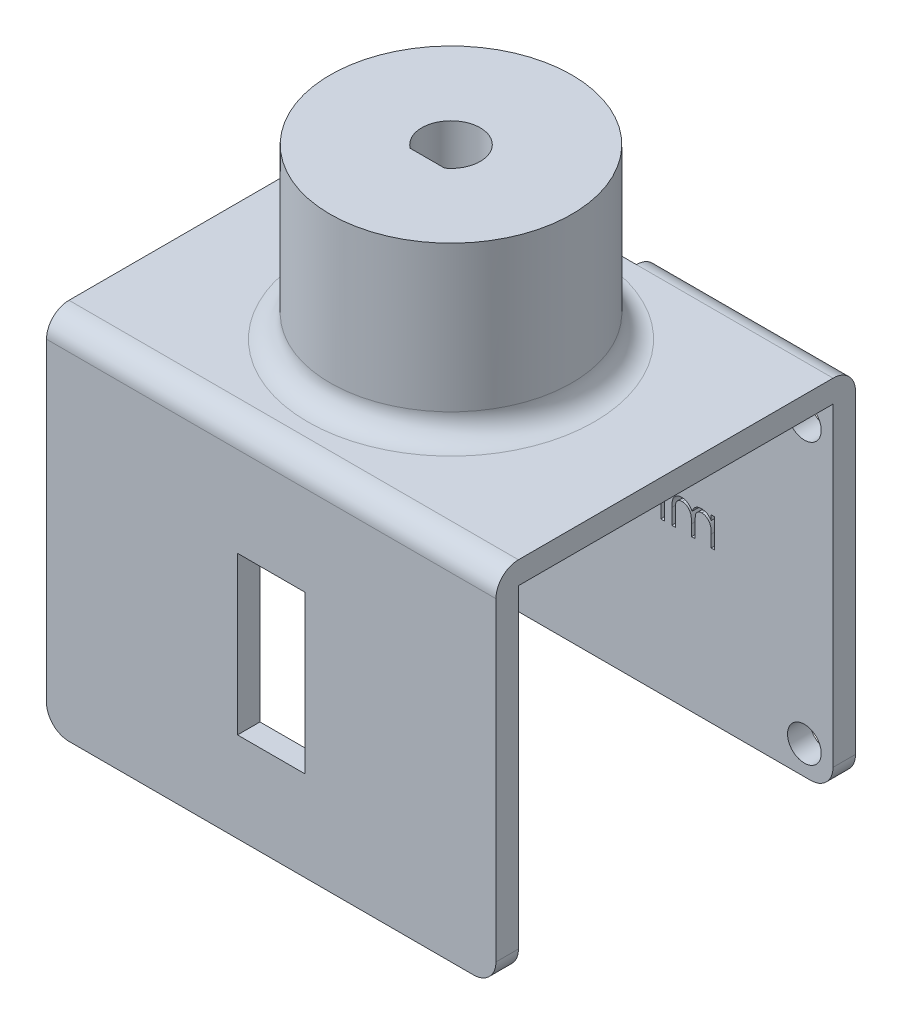
from build123d import *

# Parameters (mm, degrees)
SKETCH1_W           = 40
SKETCH1_H           = 32
BOSS_EXTRUDE1_DEPTH = 2
SKETCH2_R           = 10.75
BOSS_EXTRUDE2_DEPTH = 15
SKETCH3_R           = 8.5
CUT_EXTRUDE1_DEPTH  = 9.5
SKETCH5_W           = 4.322923329
SKETCH5_H           = 5.5
CUT_REVOLVE1_ANGLE  = 90
FILLET1_R           = 2
CUT_EXTRUDE2_REACH  = 32.741
SKETCH8_W           = 40
SKETCH8_H           = 2
BOSS_EXTRUDE3_DEPTH = 30
SKETCH10_R          = 1.5
SKETCH10_W          = 5
SKETCH10_H          = 6
SKETCH10_W_2        = 0.314102564
SKETCH10_H_2        = 2.557692307
CUT_EXTRUDE3_DEPTH  = 2
FILLET2_R           = 2
SKETCH11_W          = 6
SKETCH11_H          = 14
CUT_EXTRUDE4_DEPTH  = 10


with BuildPart() as part:
    # Sketch1 → Boss-Extrude1 (new body)
    with BuildSketch(Plane(origin=(0, 0, 0), x_dir=(1, 0, 0), z_dir=(0, 1, 0))):
        Rectangle(SKETCH1_W, SKETCH1_H)
    extrude(amount=BOSS_EXTRUDE1_DEPTH)

    # Sketch2 → Boss-Extrude2 (add)
    with BuildSketch(Plane(origin=(0, 2, 0), x_dir=(1, 0, 0), z_dir=(0, 1, 0))):
        with Locations(Location((0, 0, 0), (0, 0, 270))):
            Circle(SKETCH2_R)
    extrude(amount=BOSS_EXTRUDE2_DEPTH)

    # Sketch3 → Cut-Extrude1 (cut)
    with BuildSketch(Plane.XZ):
        with Locations(Location((0, 0, 0), (0, 0, 270))):
            Circle(SKETCH3_R)
    extrude(amount=-CUT_EXTRUDE1_DEPTH, mode=Mode.SUBTRACT)

    # Sketch5 → Cut-Revolve1 (revolve, cut)
    with BuildSketch(Plane.XY):
        with Locations((-8.588538336, 6.75)):
            Rectangle(SKETCH5_W, SKETCH5_H)
    revolve(axis=Axis((0, 0, 0), (0, -1, 0)), revolution_arc=CUT_REVOLVE1_ANGLE, mode=Mode.SUBTRACT)

    # Fillet1
    fillet1_edges = [part.edges().sort_by_distance(p)[0] for p in [
        (0, 2, -10.75),
    ]]
    fillet(fillet1_edges, radius=FILLET1_R - 0.0001)  # a hair under: the kernel refuses the full size

    # Sketch9 → Cut-Extrude2 (cut, up to next)
    with BuildSketch(Plane(origin=(0, 17, 0), x_dir=(1, 0, 0), z_dir=(0, 1, 0)), mode=Mode.PRIVATE) as cut_extrude2_sk1:
        with BuildLine():
            Line((-1.532970972, -2.1), (1.532970972, -2.1))
            ThreePointArc((1.532970972, -2.1), (0, 2.6), (-1.532970972, -2.1))
        make_face()
    cut_extrude2_tool1 = extrude(cut_extrude2_sk1.sketch, amount=-CUT_EXTRUDE2_REACH, mode=Mode.PRIVATE) & part.part
    add(cut_extrude2_tool1.solids().sort_by_distance((0, 17, -0.118931))[0], mode=Mode.SUBTRACT)

    # Sketch8 → Boss-Extrude3 (add)
    with BuildSketch(Plane.XZ):
        with Locations((0, -15)):
            Rectangle(SKETCH8_W, SKETCH8_H)
        with Locations((0, 15)):
            Rectangle(SKETCH8_W, SKETCH8_H)
    extrude(amount=BOSS_EXTRUDE3_DEPTH)

    # Sketch10 → Cut-Extrude3 (cut)
    # profile 1 of 13: a face of its own
    with BuildSketch(Plane(origin=(0, 0, -16), x_dir=(-1, 0, 0), z_dir=(0, 0, -1))):
        with Locations((-17.45, -2.55)):
            Circle(SKETCH10_R)
    # profile 2 of 13: a face of its own
    with BuildSketch(Plane(origin=(0, 0, -16), x_dir=(-1, 0, 0), z_dir=(0, 0, -1))):
        with Locations((17.45, -2.55)):
            Circle(SKETCH10_R)
    # profile 3 of 13: a face of its own
    with BuildSketch(Plane(origin=(0, 0, -16), x_dir=(-1, 0, 0), z_dir=(0, 0, -1))):
        with Locations((17.45, -27.45)):
            Circle(SKETCH10_R)
    # profile 4 of 13: a face of its own
    with BuildSketch(Plane(origin=(0, 0, -16), x_dir=(-1, 0, 0), z_dir=(0, 0, -1))):
        with Locations((-17.45, -27.45)):
            Circle(SKETCH10_R)
    # profile 5 of 13: a face of its own
    with BuildSketch(Plane(origin=(0, 0, -16), x_dir=(-1, 0, 0), z_dir=(0, 0, -1))):
        with Locations((0, -1)):
            Rectangle(SKETCH10_W, SKETCH10_H)
    # profile 6 of 13: a face of its own
    with BuildSketch(Plane(origin=(0, 0, -16), x_dir=(-1, 0, 0), z_dir=(0, 0, -1))):
        with BuildLine():
            Line((-9.472295897, -13.958841722), (-9.158193332, -13.958841722))
            Line((-9.158193332, -13.958841722), (-9.158193332, -14.403352939))
            add(Edge.make_bspline(
                [(-9.158193332, -14.403352939), (-9.129909382, -14.364465338), (-9.075714623, -14.289952965), (-8.98684897, -14.19176268), (-8.898072858, -14.108434526), (-8.834139476, -14.064691654), (-8.803425704, -14.043677459)],
                knots=[0, 0, 0, 0, 1.134379233, 2.173579362, 3.122582517, 4, 4, 4, 4], degree=3))
            add(Edge.make_bspline(
                [(-8.803425704, -14.043677459), (-8.761561042, -14.023672093), (-8.678563142, -13.98401088), (-8.547143917, -13.943777321), (-8.412669248, -13.91905222), (-8.321861034, -13.915670846), (-8.276182114, -13.913969927)],
                knots=[0, 0, 0, 0, 1.014936303, 2.012140481, 3.000054389, 4, 4, 4, 4], degree=3))
            add(Edge.make_bspline(
                [(-8.276182114, -13.913969927), (-8.245289118, -13.915015217), (-8.184153539, -13.917083792), (-8.093569449, -13.930543827), (-8.005710837, -13.95381), (-7.921096808, -13.986217324), (-7.841376128, -14.025464011), (-7.768286931, -14.071513719), (-7.702662722, -14.123210794), (-7.644536671, -14.182889727), (-7.592267646, -14.252226326), (-7.544188799, -14.333090574), (-7.499763587, -14.427298236), (-7.475142278, -14.495664777), (-7.462179711, -14.531658228)],
                knots=[0, 0, 0, 0, 1.009824226, 1.998387844, 2.986035974, 3.974953746, 4.955485308, 5.885931332, 6.793869504, 7.679848016, 8.601185859, 9.625726857, 10.749998409, 12, 12, 12, 12], degree=3))
            add(Edge.make_bspline(
                [(-7.462179711, -14.531658228), (-7.448468459, -14.506933809), (-7.421486642, -14.458279624), (-7.376181005, -14.389421361), (-7.328713209, -14.32501457), (-7.278678716, -14.265008145), (-7.226254129, -14.209698415), (-7.171192728, -14.158902513), (-7.113807947, -14.112402299), (-7.034015707, -14.05807914), (-6.9302031, -14.000377959), (-6.799314985, -13.950349515), (-6.663164813, -13.919433386), (-6.570747115, -13.915803113), (-6.524078749, -13.913969927)],
                knots=[0, 0, 0, 0, 0.86119277, 1.694706429, 2.50939023, 3.298075842, 4.073795165, 4.829715201, 5.57930267, 6.321991688, 7.768977793, 9.186738141, 10.579381044, 12, 12, 12, 12], degree=3))
            add(Edge.make_bspline(
                [(-6.524078749, -13.913969927), (-6.481197286, -13.915587148), (-6.3972741, -13.918752206), (-6.275096834, -13.943605679), (-6.161155029, -13.986283326), (-6.055677953, -14.044516963), (-5.960518139, -14.117696146), (-5.87780183, -14.204764984), (-5.808031467, -14.305107607), (-5.762452827, -14.399499595), (-5.731537563, -14.482834928), (-5.712476329, -14.55384122), (-5.695636634, -14.631992772), (-5.681655388, -14.717383034), (-5.671436836, -14.810313642), (-5.663866121, -14.910632518), (-5.658742047, -15.01841763), (-5.658379975, -15.09278313), (-5.658193332, -15.131117363)],
                knots=[0, 0, 0, 0, 1.209669288, 2.367440248, 3.500751976, 4.631527125, 5.755587489, 6.87532382, 8.007944318, 9.190864318, 9.82315674, 10.514484317, 11.263564316, 12.079023757, 12.955305781, 13.901327259, 14.918167583, 16, 16, 16, 16], degree=3))
            Line((-5.658193332, -15.131117363), (-5.658193332, -16.516534029))
            Line((-5.658193332, -16.516534029), (-5.972295897, -16.516534029))
            Line((-5.972295897, -16.516534029), (-5.972295897, -15.129715119))
            add(Edge.make_bspline(
                [(-5.972295897, -15.129715119), (-5.972373779, -15.096994545), (-5.972523459, -15.034110578), (-5.97521709, -14.943858127), (-5.980292404, -14.86158977), (-5.986227043, -14.787417682), (-5.994470852, -14.721168893), (-6.005116784, -14.662976475), (-6.016394464, -14.612382663), (-6.035130455, -14.556296616), (-6.065078347, -14.494426405), (-6.110695827, -14.427702829), (-6.168165933, -14.369622029), (-6.23452609, -14.319203712), (-6.310074534, -14.278210071), (-6.393339258, -14.248934061), (-6.483803309, -14.230811183), (-6.546426098, -14.229005167), (-6.578766249, -14.228072491)],
                knots=[0, 0, 0, 0, 1.253487763, 2.409012846, 3.458416907, 4.410876679, 5.259312806, 6.014470957, 6.676830364, 7.243083969, 8.276244668, 9.299465089, 10.325150304, 11.392391894, 12.482080715, 13.603491619, 14.762376348, 16, 16, 16, 16], degree=3))
            add(Edge.make_bspline(
                [(-6.578766249, -14.228072491), (-6.618436203, -14.229488648), (-6.696839115, -14.232287514), (-6.811284601, -14.260861386), (-6.921255617, -14.303941637), (-7.02347075, -14.366374094), (-7.117498541, -14.441182458), (-7.198398119, -14.530132054), (-7.265230304, -14.630761981), (-7.31048428, -14.723908683), (-7.339073582, -14.807578127), (-7.357950497, -14.880675499), (-7.372633889, -14.963757067), (-7.386404418, -15.056264558), (-7.395392146, -15.158834738), (-7.403560518, -15.270993139), (-7.407381381, -15.393077098), (-7.40791584, -15.477703787), (-7.408193332, -15.521642202)],
                knots=[0, 0, 0, 0, 1.090531906, 2.155305635, 3.229839962, 4.33261226, 5.44038871, 6.529323825, 7.629011124, 8.757537029, 9.370236727, 10.061839251, 10.834451254, 11.692844982, 12.636905849, 13.66920014, 14.789842145, 16, 16, 16, 16], degree=3))
            Line((-7.408193332, -15.521642202), (-7.408193332, -16.516534029))
            Line((-7.408193332, -16.516534029), (-7.722295897, -16.516534029))
            Line((-7.722295897, -16.516534029), (-7.722295897, -15.2159531))
            add(Edge.make_bspline(
                [(-7.722295897, -15.2159531), (-7.722375327, -15.179259781), (-7.722528145, -15.108665524), (-7.725204462, -15.007431848), (-7.730291084, -14.915350768), (-7.736171632, -14.832529305), (-7.744631811, -14.759117976), (-7.754241573, -14.694723218), (-7.765590183, -14.639506467), (-7.784380068, -14.578943082), (-7.813094536, -14.512222159), (-7.859282798, -14.441081138), (-7.916890379, -14.37881304), (-7.984461254, -14.325654292), (-8.060466937, -14.28171281), (-8.144450337, -14.250053059), (-8.23565525, -14.231628769), (-8.298532956, -14.229280272), (-8.330869614, -14.228072491)],
                knots=[0, 0, 0, 0, 1.320475261, 2.540461679, 3.643808994, 4.639130445, 5.527981419, 6.302341397, 6.981980563, 7.553956391, 8.582137848, 9.585246428, 10.591171744, 11.620968678, 12.668337649, 13.738356861, 14.836885341, 16, 16, 16, 16], degree=3))
            add(Edge.make_bspline(
                [(-8.330869614, -14.228072491), (-8.368885826, -14.229602951), (-8.444650785, -14.232653103), (-8.555952755, -14.260107377), (-8.663438439, -14.303111452), (-8.765393137, -14.362771271), (-8.859067286, -14.43667035), (-8.941075553, -14.523585245), (-9.010018079, -14.622434279), (-9.055749893, -14.714598795), (-9.085248368, -14.79617207), (-9.104843702, -14.865523018), (-9.121683328, -14.942523266), (-9.13419735, -15.027410377), (-9.146277765, -15.119631471), (-9.152108074, -15.219645961), (-9.157779637, -15.327368049), (-9.158052051, -15.401740594), (-9.158193332, -15.440312074)],
                knots=[0, 0, 0, 0, 1.098833095, 2.189935336, 3.297829714, 4.440610912, 5.596351641, 6.740013378, 7.886572111, 9.072425424, 9.705826452, 10.395263256, 11.156850408, 11.985370555, 12.878090359, 13.847760091, 14.883794034, 16, 16, 16, 16], degree=3))
            Line((-9.158193332, -15.440312074), (-9.158193332, -16.516534029))
            Line((-9.158193332, -16.516534029), (-9.472295897, -16.516534029))
            Line((-9.472295897, -16.516534029), (-9.472295897, -13.958841722))
        make_face()
    # profile 7 of 13: a face of its own
    with BuildSketch(Plane(origin=(0, 0, -16), x_dir=(-1, 0, 0), z_dir=(0, 0, -1))):
        with BuildLine():
            add(Edge.make_bspline(
                [(-4.829467371, -12.881918645), (-4.809976055, -12.882822797), (-4.771808315, -12.884593301), (-4.716615048, -12.899754778), (-4.666358035, -12.925454464), (-4.621780303, -12.959934144), (-4.583528416, -13.000483588), (-4.556747706, -13.047744556), (-4.539535309, -13.098803195), (-4.537456754, -13.134418284), (-4.536398461, -13.152551657)],
                knots=[0, 0, 0, 0, 1.055194115, 2.066272739, 3.074728998, 4.095836921, 5.109056067, 6.073838105, 7.019297344, 8, 8, 8, 8], degree=3))
            add(Edge.make_bspline(
                [(-4.536398461, -13.152551657), (-4.53748062, -13.170214311), (-4.539619922, -13.205131286), (-4.556734411, -13.255304758), (-4.583756648, -13.301909041), (-4.621755774, -13.342379751), (-4.666364535, -13.376840371), (-4.716613321, -13.40254511), (-4.771808769, -13.417705248), (-4.809976209, -13.419475936), (-4.829467371, -13.420380183)],
                knots=[0, 0, 0, 0, 0.96129708, 1.900370562, 2.859976407, 3.87933698, 4.906634145, 5.921202961, 6.938410037, 8, 8, 8, 8], degree=3))
            add(Edge.make_bspline(
                [(-4.829467371, -13.420380183), (-4.848735646, -13.419510463), (-4.886238826, -13.417817666), (-4.940605669, -13.402247648), (-4.990434158, -13.376831575), (-5.035098831, -13.34260539), (-5.072329024, -13.301660493), (-5.099427349, -13.255333199), (-5.116502311, -13.205124044), (-5.11864694, -13.170211878), (-5.119731794, -13.152551657)],
                knots=[0, 0, 0, 0, 1.054934014, 2.053291228, 3.073705704, 4.106921865, 5.123545215, 6.088680038, 7.033164197, 8, 8, 8, 8], degree=3))
            add(Edge.make_bspline(
                [(-5.119731794, -13.152551657), (-5.118670707, -13.134420808), (-5.116586666, -13.098810675), (-5.09941455, -13.047715642), (-5.072554742, -13.00073414), (-5.035074179, -12.959708641), (-4.990440719, -12.925463206), (-4.940603973, -12.900052225), (-4.886239274, -12.884480885), (-4.848735798, -12.882788271), (-4.829467371, -12.881918645)],
                knots=[0, 0, 0, 0, 0.98631895, 1.937192651, 2.907499808, 3.917963147, 4.944918757, 5.95915025, 6.951458133, 8, 8, 8, 8], degree=3))
        make_face()
    # profile 8 of 13: a face of its own
    with BuildSketch(Plane(origin=(0, 0, -16), x_dir=(-1, 0, 0), z_dir=(0, 0, -1))):
        with Locations((-4.828065127, -15.237687876)):
            Rectangle(SKETCH10_W_2, SKETCH10_H_2)
    # profile 9 of 13: a face of its own
    with BuildSketch(Plane(origin=(0, 0, -16), x_dir=(-1, 0, 0), z_dir=(0, 0, -1))):
        with BuildLine():
            Line((-1.30562923, -13.958841722), (-1.30562923, -16.516534029))
            Line((-1.30562923, -16.516534029), (-1.619731794, -16.516534029))
            Line((-1.619731794, -16.516534029), (-1.619731794, -16.074126177))
            add(Edge.make_bspline(
                [(-1.619731794, -16.074126177), (-1.655150585, -16.114165771), (-1.7242708, -16.192303542), (-1.839711918, -16.294385714), (-1.962080096, -16.378764036), (-2.090781417, -16.446913951), (-2.22569966, -16.498106008), (-2.366535747, -16.534492167), (-2.513347128, -16.557886002), (-2.613599483, -16.560222024), (-2.664403268, -16.561405824)],
                knots=[0, 0, 0, 0, 1.074387032, 2.096679803, 3.090159297, 4.057316773, 5.018401886, 5.985159533, 6.978961417, 8, 8, 8, 8], degree=3))
            add(Edge.make_bspline(
                [(-2.664403268, -16.561405824), (-2.709571222, -16.560179452), (-2.798644427, -16.557760991), (-2.929673504, -16.538998688), (-3.055765754, -16.508868066), (-3.177040326, -16.466967177), (-3.292712472, -16.411386355), (-3.403772568, -16.344845107), (-3.50964526, -16.265604277), (-3.608716799, -16.175016249), (-3.6999488, -16.076621261), (-3.780010072, -15.971675714), (-3.846763152, -15.860633411), (-3.902583233, -15.744900257), (-3.945579577, -15.623585337), (-3.975553212, -15.497108169), (-3.994293658, -15.365618296), (-3.996711119, -15.276078773), (-3.997936922, -15.230676657)],
                knots=[0, 0, 0, 0, 1.033919861, 2.038935746, 3.024066025, 3.998881131, 4.97069526, 5.957263378, 6.95902576, 7.993208707, 9.027059324, 10.027763471, 11.009749337, 11.988697705, 12.965288445, 13.950418724, 14.960734635, 16, 16, 16, 16], degree=3))
            add(Edge.make_bspline(
                [(-3.997936922, -15.230676657), (-3.996683951, -15.186212954), (-3.994206894, -15.098310611), (-3.975753674, -14.969031913), (-3.944722665, -14.844513652), (-3.901174818, -14.725156709), (-3.845332863, -14.610816658), (-3.777404776, -14.501412633), (-3.697385651, -14.396643236), (-3.605133244, -14.298972009), (-3.505198474, -14.208751395), (-3.398289743, -14.130342349), (-3.287066462, -14.062625501), (-3.169803451, -14.008972024), (-3.048236346, -13.96556292), (-2.921282901, -13.935529952), (-2.789471322, -13.91783263), (-2.69998083, -13.915269866), (-2.654587563, -13.913969927)],
                knots=[0, 0, 0, 0, 1.020392517, 2.01726096, 2.990465484, 3.961182959, 4.928053699, 5.906110375, 6.912531644, 7.948652711, 8.985773172, 9.998621852, 10.987621588, 11.969261332, 12.953316658, 13.946091881, 14.958173133, 16, 16, 16, 16], degree=3))
            add(Edge.make_bspline(
                [(-2.654587563, -13.913969927), (-2.602387704, -13.915407678), (-2.500026244, -13.918227041), (-2.350298235, -13.941689768), (-2.208653757, -13.981328236), (-2.073999405, -14.035245734), (-1.946818719, -14.106894463), (-1.828315735, -14.197274424), (-1.717250251, -14.305815611), (-1.65286996, -14.389186055), (-1.619731794, -14.432098933)],
                knots=[0, 0, 0, 0, 1.038897134, 2.037228247, 3.008116434, 3.962042015, 4.918381754, 5.904844433, 6.921570401, 8, 8, 8, 8], degree=3))
            Line((-1.619731794, -14.432098933), (-1.619731794, -13.958841722))
            Line((-1.619731794, -13.958841722), (-1.30562923, -13.958841722))
        make_face()
        with BuildLine():
            add(Edge.make_bspline(
                [(-2.650380832, -14.228072491), (-2.69629517, -14.229706128), (-2.78692277, -14.23293067), (-2.919966772, -14.258104165), (-3.047280186, -14.299988759), (-3.168226261, -14.35727066), (-3.280894477, -14.429299397), (-3.381588148, -14.51642078), (-3.471130849, -14.616257794), (-3.546439114, -14.728359905), (-3.607829611, -14.848537996), (-3.650996643, -14.974162434), (-3.67946589, -15.102967411), (-3.682374411, -15.190330097), (-3.683834358, -15.234182266)],
                knots=[0, 0, 0, 0, 1.031046209, 2.035121221, 3.029706178, 4.034933723, 5.034054252, 6.02443088, 7.017295772, 8.038157696, 9.050218397, 10.03989886, 11.016116709, 12, 12, 12, 12], degree=3))
            add(Edge.make_bspline(
                [(-3.683834358, -15.234182266), (-3.681969465, -15.277772374), (-3.678246988, -15.364781729), (-3.651496293, -15.493762306), (-3.60661642, -15.619416348), (-3.545374357, -15.740677342), (-3.468687733, -15.853261442), (-3.37979908, -15.955001565), (-3.277848799, -16.042491153), (-3.164921292, -16.115728727), (-3.044313321, -16.174891247), (-2.91747939, -16.216056887), (-2.786803752, -16.242634668), (-2.697951418, -16.245739144), (-2.65318532, -16.24730326)],
                knots=[0, 0, 0, 0, 0.979072187, 1.954306742, 2.945804271, 3.96968567, 4.997920485, 5.998718438, 6.996577872, 8.005894225, 9.015743152, 10.005417472, 10.995077863, 12, 12, 12, 12], degree=3))
            add(Edge.make_bspline(
                [(-2.65318532, -16.24730326), (-2.607738817, -16.245643296), (-2.51735023, -16.242341792), (-2.383911522, -16.217060527), (-2.25441656, -16.175291729), (-2.130629331, -16.117392602), (-2.0153132, -16.045635246), (-1.911815322, -15.961628155), (-1.824299354, -15.863924971), (-1.750106745, -15.756548518), (-1.691931328, -15.638836522), (-1.649555269, -15.513502331), (-1.624501363, -15.380541583), (-1.621343633, -15.289677656), (-1.619731794, -15.24329685)],
                knots=[0, 0, 0, 0, 1.01762866, 2.023962475, 3.030623092, 4.058876274, 5.077231937, 6.066672613, 7.034107872, 8.005628644, 8.981990164, 9.965428785, 10.961468474, 12, 12, 12, 12], degree=3))
            add(Edge.make_bspline(
                [(-1.619731794, -15.24329685), (-1.62069145, -15.207959019), (-1.622580358, -15.138402986), (-1.637010927, -15.036275468), (-1.659965854, -14.938541742), (-1.692312024, -14.845099053), (-1.734803308, -14.756464038), (-1.786051074, -14.672000278), (-1.846956524, -14.592147066), (-1.91653922, -14.518003995), (-1.992704422, -14.450377533), (-2.073298963, -14.390013292), (-2.15927771, -14.34042452), (-2.249194747, -14.299383248), (-2.343206081, -14.266724098), (-2.442076701, -14.244936404), (-2.544755688, -14.229976083), (-2.614801743, -14.228713703), (-2.650380832, -14.228072491)],
                knots=[0, 0, 0, 0, 1.050140795, 2.067009409, 3.05949893, 4.030605086, 5.00011959, 5.97591094, 6.962425594, 7.979863591, 8.993523472, 9.986985069, 10.967611495, 11.937549037, 12.921786183, 13.919465291, 14.943216303, 16, 16, 16, 16], degree=3))
        make_face(mode=Mode.SUBTRACT)
    # profile 10 of 13: a face of its own
    with BuildSketch(Plane(origin=(0, 0, -16), x_dir=(-1, 0, 0), z_dir=(0, 0, -1))):
        with BuildLine():
            add(Edge.make_bspline(
                [(0.647696091, -13.913969927), (0.695687364, -13.914991818), (0.789786521, -13.916995497), (0.927594407, -13.938410462), (1.059139543, -13.971157827), (1.184925735, -14.016429389), (1.303342031, -14.077111339), (1.416113275, -14.14952063), (1.522930284, -14.235303224), (1.586953313, -14.301661292), (1.619450898, -14.335344125)],
                knots=[0, 0, 0, 0, 1.054011418, 2.066658804, 3.057071809, 4.030435133, 4.997543892, 5.974964718, 6.972108034, 8, 8, 8, 8], degree=3))
            add(Edge.make_bspline(
                [(1.619450898, -14.335344125), (1.647432852, -14.367558111), (1.702855233, -14.431362653), (1.773920951, -14.534818266), (1.835142512, -14.641958367), (1.884205473, -14.754205694), (1.922890496, -14.870580365), (1.950356193, -14.991482376), (1.966693127, -15.116644723), (1.968896094, -15.201648561), (1.970011796, -15.244699093)],
                knots=[0, 0, 0, 0, 1.025258237, 2.030674902, 3.01204498, 3.988269485, 4.97094183, 5.956517959, 6.965070386, 8, 8, 8, 8], degree=3))
            add(Edge.make_bspline(
                [(1.970011796, -15.244699093), (1.969030458, -15.287999151), (1.96709129, -15.373562084), (1.948747674, -15.49958145), (1.920216588, -15.621776273), (1.87938475, -15.739634967), (1.82702664, -15.853517794), (1.763135953, -15.962927343), (1.687264336, -16.068079477), (1.601260339, -16.168081315), (1.506208463, -16.26024753), (1.403092315, -16.340575799), (1.293938281, -16.409397323), (1.177294928, -16.464833739), (1.054227441, -16.508543439), (0.924470373, -16.539243456), (0.788225302, -16.55780514), (0.695198081, -16.560188713), (0.647696091, -16.561405824)],
                knots=[0, 0, 0, 0, 0.998656419, 1.973391657, 2.932242238, 3.890759089, 4.846373663, 5.82037756, 6.809684879, 7.83454468, 8.860553229, 9.859544525, 10.845671541, 11.83227036, 12.833544569, 13.85385346, 14.904124723, 16, 16, 16, 16], degree=3))
            add(Edge.make_bspline(
                [(0.647696091, -16.561405824), (0.599961371, -16.560184628), (0.506470511, -16.557792853), (0.36974453, -16.539315571), (0.239754911, -16.508557588), (0.116526312, -16.464690095), (-0.000618535, -16.409395552), (-0.110405032, -16.340783862), (-0.213604947, -16.260223707), (-0.308676932, -16.16808777), (-0.394675537, -16.068077813), (-0.470548545, -15.962927775), (-0.534438872, -15.853517681), (-0.586797075, -15.739634997), (-0.627628888, -15.621776265), (-0.656159981, -15.499581452), (-0.674503596, -15.373562084), (-0.676442764, -15.287999151), (-0.677424102, -15.244699093)],
                knots=[0, 0, 0, 0, 1.099876186, 2.154163076, 3.173186993, 4.173200201, 5.163417411, 6.152872554, 7.150605724, 8.17532212, 9.198891216, 10.186952605, 11.159729845, 12.11414092, 13.071450619, 14.029093627, 15.002601286, 16, 16, 16, 16], degree=3))
            add(Edge.make_bspline(
                [(-0.677424102, -15.244699093), (-0.676300791, -15.201882547), (-0.67407683, -15.117113145), (-0.657756321, -14.992186084), (-0.630397764, -14.871488695), (-0.591666368, -14.755563219), (-0.542151177, -14.643807783), (-0.481789889, -14.536402952), (-0.409999256, -14.433415152), (-0.354797305, -14.369693072), (-0.326863204, -14.337447491)],
                knots=[0, 0, 0, 0, 1.031353054, 2.041901799, 3.029428768, 4.008703097, 4.981709435, 5.96992636, 6.972712378, 8, 8, 8, 8], degree=3))
            add(Edge.make_bspline(
                [(-0.326863204, -14.337447491), (-0.294414613, -14.303472551), (-0.230598749, -14.236654855), (-0.123250022, -14.151122331), (-0.0107562, -14.077206257), (0.108968726, -14.017730042), (0.234651584, -13.970891524), (0.366870826, -13.938326009), (0.505146342, -13.917072654), (0.599705963, -13.915014476), (0.647696091, -13.913969927)],
                knots=[0, 0, 0, 0, 1.027980169, 2.021703884, 2.998553061, 3.971491411, 4.943284454, 5.930300938, 6.949603206, 8, 8, 8, 8], degree=3))
        make_face()
        with BuildLine():
            add(Edge.make_bspline(
                [(0.646293847, -14.228072491), (0.612356236, -14.229037082), (0.545357107, -14.230941365), (0.446737522, -14.24542527), (0.351797368, -14.268372774), (0.260356524, -14.30097683), (0.172723352, -14.343075729), (0.088813949, -14.394784089), (0.00838151, -14.455417046), (-0.067000554, -14.524879717), (-0.136182866, -14.600758712), (-0.196660843, -14.681607071), (-0.248085949, -14.766113417), (-0.290926108, -14.854365628), (-0.322833296, -14.947258042), (-0.346006318, -15.043738673), (-0.360476559, -15.14400409), (-0.362362937, -15.212165108), (-0.363321538, -15.246802459)],
                knots=[0, 0, 0, 0, 1.021534396, 2.016698045, 2.994645724, 3.958388632, 4.93408049, 5.916473867, 6.921342795, 7.962252576, 8.998418191, 10.008913653, 10.997312074, 11.973003931, 12.956656626, 13.948281152, 14.957379055, 16, 16, 16, 16], degree=3))
            add(Edge.make_bspline(
                [(-0.363321538, -15.246802459), (-0.361714714, -15.291554486), (-0.358525469, -15.380378891), (-0.332590233, -15.511190014), (-0.289203953, -15.636771866), (-0.230616673, -15.756388252), (-0.157210455, -15.86706053), (-0.070723388, -15.965732015), (0.027916312, -16.050917826), (0.137532812, -16.121598672), (0.25588713, -16.177758427), (0.381143452, -16.217557403), (0.511784146, -16.243429095), (0.601064877, -16.24600057), (0.646293847, -16.24730326)],
                knots=[0, 0, 0, 0, 1.016792936, 2.018143844, 3.017858371, 4.030088057, 5.03801393, 6.028138512, 7.003788237, 7.991172063, 8.984598303, 9.972568034, 10.972917682, 12, 12, 12, 12], degree=3))
            add(Edge.make_bspline(
                [(0.646293847, -16.24730326), (0.691520216, -16.24599298), (0.780795812, -16.243406523), (0.911254989, -16.217687703), (1.036168961, -16.177584042), (1.154400348, -16.121661833), (1.263966952, -16.050649418), (1.363316073, -15.966213041), (1.449064684, -15.866799189), (1.522398289, -15.756241661), (1.581945032, -15.636957308), (1.625128234, -15.511166836), (1.651125819, -15.380384794), (1.654306648, -15.291556463), (1.655909232, -15.246802459)],
                knots=[0, 0, 0, 0, 1.02726834, 2.027799167, 3.010890988, 4.004497153, 4.992059811, 5.971914811, 6.958719428, 7.966827853, 8.981595046, 9.981490638, 10.983022906, 12, 12, 12, 12], degree=3))
            add(Edge.make_bspline(
                [(1.655909232, -15.246802459), (1.654950962, -15.212164901), (1.653065233, -15.144003475), (1.638590268, -15.043741022), (1.615434729, -14.947249425), (1.583463111, -14.854397422), (1.540809097, -14.765884918), (1.488392304, -14.68185519), (1.428161279, -14.600478644), (1.358144158, -14.525125004), (1.28284078, -14.455389967), (1.202375742, -14.394760578), (1.118590763, -14.343302982), (1.031212181, -14.300616742), (0.939759613, -14.268669401), (0.844952484, -14.24529277), (0.746753674, -14.231002573), (0.679994631, -14.229055432), (0.646293847, -14.228072491)],
                knots=[0, 0, 0, 0, 1.042956736, 2.052379634, 3.044323526, 4.02829302, 5.004299113, 5.996692471, 7.007513377, 8.048758398, 9.090003419, 10.095195979, 11.07790575, 12.047570684, 13.018257071, 13.989683339, 14.985167495, 16, 16, 16, 16], degree=3))
        make_face(mode=Mode.SUBTRACT)
    # profile 11 of 13: a face of its own
    with BuildSketch(Plane(origin=(0, 0, -16), x_dir=(-1, 0, 0), z_dir=(0, 0, -1))):
        with BuildLine():
            Line((4.168729745, -14.093457106), (3.85462718, -14.093457106))
            add(Edge.make_bspline(
                [(3.85462718, -14.093457106), (3.856674333, -14.051786218), (3.860694887, -13.969945704), (3.879523177, -13.850621797), (3.906464054, -13.736566999), (3.944555508, -13.628697085), (3.991861786, -13.526058277), (4.048591813, -13.429058262), (4.115785664, -13.338067073), (4.191992398, -13.25392823), (4.274761037, -13.176740659), (4.364066976, -13.110085416), (4.457912003, -13.053767745), (4.556011402, -13.006686503), (4.659471966, -12.971346657), (4.767354824, -12.945125017), (4.88013396, -12.929348672), (4.956973982, -12.927652886), (4.996053462, -12.926790439)],
                knots=[0, 0, 0, 0, 1.10065271, 2.161652631, 3.183658789, 4.190468796, 5.17591951, 6.163126047, 7.15150782, 8.156236427, 9.156009102, 10.134482811, 11.092018607, 12.041330605, 13.001268258, 13.972401359, 14.968799086, 16, 16, 16, 16], degree=3))
            add(Edge.make_bspline(
                [(4.996053462, -12.926790439), (5.034431537, -12.927688896), (5.109843081, -12.929454331), (5.219905096, -12.94461536), (5.32468239, -12.968360952), (5.423970157, -13.001676368), (5.516976221, -13.046460795), (5.604399266, -13.100258334), (5.687280077, -13.162478165), (5.76188686, -13.235731979), (5.830394939, -13.313934363), (5.889497195, -13.397422267), (5.940110358, -13.483651553), (5.982298038, -13.573279754), (6.013354177, -13.667150783), (6.036932385, -13.763897985), (6.050259799, -13.864522796), (6.052305222, -13.932629352), (6.053345129, -13.967255183)],
                knots=[0, 0, 0, 0, 1.111607364, 2.184268762, 3.212621178, 4.221274766, 5.211760367, 6.196651075, 7.1921475, 8.207485113, 9.220403448, 10.201281604, 11.166441695, 12.114753415, 13.065576456, 14.026450734, 14.996634279, 16, 16, 16, 16], degree=3))
            add(Edge.make_bspline(
                [(6.053345129, -13.967255183), (6.051651866, -14.016003018), (6.048295055, -14.112643231), (6.019580678, -14.254658094), (5.974734167, -14.392251513), (5.92073681, -14.502988815), (5.866264366, -14.592222309), (5.817176859, -14.665691014), (5.759712048, -14.744796482), (5.69303355, -14.82927382), (5.618520678, -14.919784725), (5.535498514, -15.01627452), (5.443375032, -15.11774629), (5.378716531, -15.187051891), (5.345212116, -15.222964318)],
                knots=[0, 0, 0, 0, 1.184426356, 2.348067706, 3.509069118, 4.696110526, 5.333549288, 6.050745305, 6.844228056, 7.710549037, 8.667450064, 9.695053472, 10.805634456, 12, 12, 12, 12], degree=3))
            Line((5.345212116, -15.222964318), (4.469510995, -16.15755967))
            Line((4.469510995, -16.15755967), (6.098216924, -16.15755967))
            Line((6.098216924, -16.15755967), (6.098216924, -16.516534029))
            Line((6.098216924, -16.516534029), (3.720011796, -16.516534029))
            Line((3.720011796, -16.516534029), (5.077383591, -15.068016401))
            add(Edge.make_bspline(
                [(5.077383591, -15.068016401), (5.110431477, -15.033518094), (5.173909705, -14.967253908), (5.263692281, -14.870510948), (5.34433127, -14.780761407), (5.416348662, -14.698174859), (5.478182168, -14.621543291), (5.5330544, -14.553348587), (5.577019991, -14.490594137), (5.624735386, -14.417853523), (5.670949368, -14.329041206), (5.710661724, -14.220507516), (5.734876572, -14.108780264), (5.737781408, -14.033278227), (5.739242565, -13.995300055)],
                knots=[0, 0, 0, 0, 1.329631726, 2.553950428, 3.673215718, 4.687767853, 5.603093632, 6.413772471, 7.123043292, 7.734684054, 8.834405432, 9.900288307, 10.943827018, 12, 12, 12, 12], degree=3))
            add(Edge.make_bspline(
                [(5.739242565, -13.995300055), (5.738606823, -13.971418656), (5.737353897, -13.924353006), (5.726296199, -13.855347247), (5.709585693, -13.788782433), (5.685640435, -13.724453814), (5.654033695, -13.663008162), (5.615560315, -13.604370682), (5.571170252, -13.547681717), (5.519818982, -13.494528419), (5.463407463, -13.445847213), (5.403813213, -13.402723128), (5.340763109, -13.366684017), (5.274522987, -13.33714052), (5.205277517, -13.313965139), (5.132892772, -13.297906559), (5.057568756, -13.287824075), (5.00613526, -13.286459903), (4.979927661, -13.285764798)],
                knots=[0, 0, 0, 0, 0.991446411, 1.95395049, 2.89581595, 3.838931463, 4.798493298, 5.75982156, 6.748411868, 7.785213223, 8.824556874, 9.840280684, 10.836137867, 11.835679398, 12.848801643, 13.863922112, 14.911575587, 16, 16, 16, 16], degree=3))
            add(Edge.make_bspline(
                [(4.979927661, -13.285764798), (4.952556828, -13.286479831), (4.898805032, -13.287884036), (4.819885999, -13.2977067), (4.744600222, -13.31465254), (4.672758319, -13.337829215), (4.604238733, -13.367287764), (4.539374689, -13.403979508), (4.4783118, -13.447763001), (4.420935276, -13.497403558), (4.368071297, -13.552671159), (4.321624421, -13.614281122), (4.281040407, -13.681108537), (4.245631174, -13.752973088), (4.216875484, -13.830526868), (4.194902333, -13.913494573), (4.177515487, -14.001515954), (4.171706966, -14.062301039), (4.168729745, -14.093457106)],
                knots=[0, 0, 0, 0, 1.031018746, 2.02475058, 2.990194455, 3.934040569, 4.864654155, 5.795059489, 6.735614925, 7.690564532, 8.649604399, 9.611025574, 10.590972636, 11.591080095, 12.624614302, 13.701020113, 14.821632451, 16, 16, 16, 16], degree=3))
        make_face()
    # profile 12 of 13: a face of its own
    with BuildSketch(Plane(origin=(0, 0, -16), x_dir=(-1, 0, 0), z_dir=(0, 0, -1))):
        with BuildLine():
            add(Edge.make_bspline(
                [(6.973216924, -15.978072491), (6.992707136, -15.979230657), (7.030915419, -15.981501108), (7.086154547, -15.997077782), (7.136149207, -16.024736442), (7.180681451, -16.06159922), (7.217387928, -16.106294884), (7.24603228, -16.155890792), (7.261473265, -16.211592385), (7.263727177, -16.25002206), (7.264883591, -16.269739157)],
                knots=[0, 0, 0, 0, 1.020151414, 1.999887582, 2.974338812, 3.990962822, 5.007586832, 5.987933904, 6.967670073, 8, 8, 8, 8], degree=3))
            add(Edge.make_bspline(
                [(7.264883591, -16.269739157), (7.26368799, -16.288982487), (7.261330283, -16.326930051), (7.246067675, -16.382211513), (7.217169624, -16.431838418), (7.180934632, -16.477140556), (7.136138198, -16.514081427), (7.086036352, -16.541504771), (7.031045093, -16.558196751), (6.99272877, -16.560323048), (6.973216924, -16.561405824)],
                knots=[0, 0, 0, 0, 1.009421747, 1.99056486, 2.972319754, 3.999869655, 5.017953583, 5.993804169, 6.978383603, 8, 8, 8, 8], degree=3))
            add(Edge.make_bspline(
                [(6.973216924, -16.561405824), (6.953691018, -16.560362227), (6.915571336, -16.558324852), (6.860785342, -16.541162046), (6.810378373, -16.514338585), (6.765590661, -16.477071676), (6.72905219, -16.432071532), (6.701426807, -16.381869736), (6.684836658, -16.327088299), (6.682654785, -16.289013656), (6.681550257, -16.269739157)],
                knots=[0, 0, 0, 0, 1.022052826, 1.995314843, 2.982371812, 4.00089066, 5.028879526, 6.005146991, 6.990147033, 8, 8, 8, 8], degree=3))
            add(Edge.make_bspline(
                [(6.681550257, -16.269739157), (6.682612357, -16.249989778), (6.684685975, -16.211431538), (6.701461635, -16.15623243), (6.728837847, -16.106063991), (6.765843242, -16.061667411), (6.810367538, -16.024480108), (6.860663743, -15.997415315), (6.915703284, -15.981374903), (6.953713222, -15.979192386), (6.973216924, -15.978072491)],
                knots=[0, 0, 0, 0, 1.032775665, 2.016367738, 2.991239715, 4.008302682, 5.025365648, 6.011011707, 6.979408107, 8, 8, 8, 8], degree=3))
        make_face()
    # profile 13 of 13: a face of its own
    with BuildSketch(Plane(origin=(0, 0, -16), x_dir=(-1, 0, 0), z_dir=(0, 0, -1))):
        with BuildLine():
            add(Edge.make_bspline(
                [(7.713601539, -14.767936273), (7.713929558, -14.711838885), (7.714566738, -14.602868901), (7.721655158, -14.444084259), (7.733430501, -14.29512397), (7.749567874, -14.155980904), (7.769205854, -14.026619139), (7.79542134, -13.907384382), (7.825234143, -13.797724775), (7.859786589, -13.697282727), (7.898774378, -13.604705024), (7.941208639, -13.518279823), (7.988773433, -13.43813789), (8.038750346, -13.3630001), (8.093162418, -13.294096405), (8.150461208, -13.230453743), (8.212883084, -13.173542992), (8.278306093, -13.12169669), (8.347322557, -13.076247218), (8.417965223, -13.036214479), (8.490720329, -13.002014612), (8.565786512, -12.975124176), (8.64248907, -12.95291333), (8.721096136, -12.937724382), (8.8017375, -12.928167473), (8.856168935, -12.927253806), (8.883773815, -12.926790439)],
                knots=[0, 0, 0, 0, 1.646270934, 3.197905019, 4.663502075, 6.030701355, 7.308322542, 8.50163776, 9.611534131, 10.641858119, 11.616356847, 12.558055219, 13.465016945, 14.349605745, 15.204443733, 16.039544428, 16.859896111, 17.680448484, 18.487036065, 19.28249412, 20.06191084, 20.843045899, 21.620316918, 22.403196591, 23.190181807, 24, 24, 24, 24], degree=3))
            add(Edge.make_bspline(
                [(8.883773815, -12.926790439), (8.911609294, -12.927278255), (8.966965302, -12.928248366), (9.048805678, -12.937572308), (9.128755359, -12.953043431), (9.206473498, -12.974964406), (9.282598485, -13.002160082), (9.356534892, -13.0362472), (9.428741974, -13.075926067), (9.498072261, -13.122549944), (9.565286877, -13.17453222), (9.62873484, -13.233294889), (9.688421926, -13.298244608), (9.745097231, -13.368686472), (9.797152828, -13.445971557), (9.84672626, -13.528755667), (9.891098296, -13.618486532), (9.933832971, -13.713667), (9.970719958, -13.816930658), (10.003986203, -13.927695419), (10.030865172, -14.047269606), (10.053254444, -14.175025851), (10.07059934, -14.311433334), (10.083231982, -14.45619965), (10.089905067, -14.60942004), (10.091161769, -14.71417789), (10.091806668, -14.767936273)],
                knots=[0, 0, 0, 0, 0.810914788, 1.612654377, 2.396697861, 3.181598691, 3.963628158, 4.749916497, 5.551656086, 6.361998678, 7.18212741, 8.025565596, 8.878627764, 9.750805457, 10.657531673, 11.591944965, 12.560506719, 13.57287815, 14.630710178, 15.753379473, 16.941251878, 18.199788006, 19.531962791, 20.947069417, 22.433333509, 24, 24, 24, 24], degree=3))
            add(Edge.make_bspline(
                [(10.091806668, -14.767936273), (10.091155083, -14.821460181), (10.089885497, -14.925749333), (10.08330679, -15.078280308), (10.070348159, -15.222278351), (10.054138171, -15.358088814), (10.031687208, -15.485146433), (10.004082042, -15.603890881), (9.973431719, -15.714834953), (9.935596925, -15.817069764), (9.894186214, -15.912021487), (9.849131018, -16.000688635), (9.800861192, -16.083854928), (9.748272447, -16.160854675), (9.692219034, -16.232233332), (9.631501245, -16.296730955), (9.56783066, -16.355901627), (9.500418244, -16.408553254), (9.430006693, -16.454638059), (9.358047616, -16.495851909), (9.283264233, -16.529084604), (9.20735128, -16.557619645), (9.129222914, -16.579420097), (9.048976523, -16.594493953), (8.967020287, -16.605065801), (8.911618722, -16.605872281), (8.883773815, -16.606277619)],
                knots=[0, 0, 0, 0, 1.561518951, 3.042555995, 4.452378317, 5.7783523, 7.031515105, 8.214008947, 9.334062868, 10.386615937, 11.391082383, 12.354592575, 13.286541444, 14.194233754, 15.072674879, 15.931287219, 16.775624067, 17.606195743, 18.42308326, 19.229000347, 20.022332153, 20.807536673, 21.593273796, 22.3848459, 23.188221202, 24, 24, 24, 24], degree=3))
            add(Edge.make_bspline(
                [(8.883773815, -16.606277619), (8.856169701, -16.605811263), (8.801739776, -16.604891702), (8.721087351, -16.59537797), (8.642804907, -16.580082467), (8.566506153, -16.558665863), (8.491799638, -16.532451026), (8.419703352, -16.498297343), (8.349415668, -16.458963274), (8.281124112, -16.414167852), (8.216111951, -16.362846169), (8.154013346, -16.306081881), (8.096388326, -16.242458469), (8.042754231, -16.172980546), (7.991780143, -16.098287304), (7.944890769, -16.017358931), (7.901519915, -15.93051632), (7.861876425, -15.83719841), (7.826727761, -15.736043482), (7.795680053, -15.625894303), (7.771165895, -15.505778667), (7.75018294, -15.3766613), (7.733258557, -15.23798737), (7.721704232, -15.089681592), (7.714562917, -14.931836383), (7.713927846, -14.823566608), (7.713601539, -14.767936273)],
                knots=[0, 0, 0, 0, 0.810891512, 1.598919785, 2.382837074, 3.152667961, 3.926044502, 4.706494248, 5.493654104, 6.291793342, 7.103789334, 7.925228297, 8.761435821, 9.622817696, 10.50288917, 11.416980706, 12.369136599, 13.353924996, 14.394355917, 15.514179734, 16.714354668, 17.994756427, 19.357759367, 20.818452758, 22.365282078, 24, 24, 24, 24], degree=3))
        make_face()
        with BuildLine():
            add(Edge.make_bspline(
                [(8.027704103, -14.766534029), (8.027823551, -14.813282728), (8.028055374, -14.904012773), (8.034111574, -15.035856034), (8.042361806, -15.158826363), (8.053003104, -15.273079899), (8.068806052, -15.378229912), (8.08651284, -15.474999595), (8.10806093, -15.562876832), (8.133555947, -15.642464642), (8.162595044, -15.715113711), (8.194300908, -15.782714926), (8.228361631, -15.846066863), (8.266480781, -15.904600471), (8.307995845, -15.958506635), (8.351969104, -16.008739467), (8.400041688, -16.053536449), (8.466545431, -16.107263304), (8.554341905, -16.162782437), (8.66496236, -16.211128527), (8.778630811, -16.241510984), (8.855782061, -16.24537474), (8.894290642, -16.24730326)],
                knots=[0, 0, 0, 0, 1.459021318, 2.831673884, 4.118529203, 5.306027144, 6.411944654, 7.436330062, 8.375795394, 9.233974572, 10.042671642, 10.816086306, 11.563610507, 12.285937304, 12.993564865, 13.685989202, 14.367179055, 15.041617293, 16.353048772, 17.594441528, 18.799311195, 20, 20, 20, 20], degree=3))
            add(Edge.make_bspline(
                [(8.894290642, -16.24730326), (8.933048314, -16.245705479), (9.010483637, -16.242513216), (9.123617432, -16.211714479), (9.233447702, -16.16524494), (9.319519642, -16.110297434), (9.385002186, -16.057969105), (9.431919176, -16.013354456), (9.474981224, -15.963398589), (9.515823299, -15.909499293), (9.553282375, -15.850626809), (9.587345513, -15.787064234), (9.61842886, -15.718635056), (9.636137906, -15.670865317), (9.645192084, -15.646441882)],
                knots=[0, 0, 0, 0, 1.353760809, 2.704726607, 4.075137775, 5.516104923, 6.260822281, 7.007110065, 7.778089737, 8.566572457, 9.372053459, 10.217411131, 11.088608312, 12, 12, 12, 12], degree=3))
            add(Edge.make_bspline(
                [(9.645192084, -15.646441882), (9.655743852, -15.615212142), (9.677168466, -15.551802378), (9.70478024, -15.453438726), (9.726525639, -15.350235962), (9.746089005, -15.242810845), (9.759442061, -15.130371144), (9.770189874, -15.01326476), (9.776520561, -14.891403398), (9.777305312, -14.808608407), (9.777704103, -14.766534029)],
                knots=[0, 0, 0, 0, 0.884706709, 1.796334032, 2.740027952, 3.714592787, 4.726048262, 5.777819803, 6.87074269, 8, 8, 8, 8], degree=3))
            add(Edge.make_bspline(
                [(9.777704103, -14.766534029), (9.777153914, -14.724466457), (9.776077627, -14.642173292), (9.771963639, -14.521655111), (9.761340064, -14.40718735), (9.749540945, -14.298276878), (9.732143724, -14.195526575), (9.713385917, -14.09807627), (9.688184705, -14.007133245), (9.66126493, -13.921273663), (9.630454535, -13.841473009), (9.5965388, -13.767359222), (9.560317042, -13.698574498), (9.520974801, -13.635307556), (9.478979118, -13.577275013), (9.433221569, -13.525640419), (9.385517196, -13.47880345), (9.31870001, -13.425340881), (9.23122572, -13.370829186), (9.122380073, -13.320663426), (9.009109429, -13.291855133), (8.932535975, -13.287793446), (8.894290642, -13.285764798)],
                knots=[0, 0, 0, 0, 1.31362396, 2.569729283, 3.763502607, 4.902122613, 5.988968491, 7.01645872, 7.998833611, 8.933434873, 9.825090667, 10.667526885, 11.477055099, 12.250526234, 12.991942729, 13.710640831, 14.402115721, 15.076753259, 16.378508321, 17.609869233, 18.806226677, 20, 20, 20, 20], degree=3))
            add(Edge.make_bspline(
                [(8.894290642, -13.285764798), (8.85558005, -13.287796245), (8.778088344, -13.291862839), (8.66364039, -13.320556093), (8.553936038, -13.370569059), (8.466693063, -13.425521431), (8.399829277, -13.477859743), (8.352746583, -13.523246197), (8.308600411, -13.572892451), (8.267932711, -13.627294366), (8.229843428, -13.685759733), (8.194862415, -13.748748498), (8.163345086, -13.816579862), (8.134260549, -13.889196298), (8.108687761, -13.968777242), (8.087593798, -14.056546236), (8.068106745, -14.153008127), (8.054311476, -14.258727635), (8.04204772, -14.373009789), (8.034166372, -14.496287107), (8.028035115, -14.628351487), (8.027816651, -14.719550646), (8.027704103, -14.766534029)],
                knots=[0, 0, 0, 0, 1.207732386, 2.417664972, 3.655092373, 4.956220595, 5.625982001, 6.301752483, 6.994047911, 7.697131622, 8.419323945, 9.170223765, 9.943494443, 10.752040957, 11.610060368, 12.549350801, 13.567764191, 14.679664412, 15.874934091, 17.154273443, 18.533957287, 20, 20, 20, 20], degree=3))
        make_face(mode=Mode.SUBTRACT)
    extrude(amount=-CUT_EXTRUDE3_DEPTH, mode=Mode.SUBTRACT)


with BuildPart() as cut_extrude3_piece_1:
    # of the separate pieces the step leaves, piece 1, a body of its own (cut_extrude3_pieces)
    add(part.part.solids().sort_by_distance((20, 2, 16))[0])

    # Fillet2
    fillet2_edges = [cut_extrude3_piece_1.edges().sort_by_distance(p)[0] for p in [
        (-11.25, 2, -16),
        (0, 2, 16),
        (-20, -30, 15),
        (20, -30, 15),
        (20, -30, -15),
        (-20, -30, -15),
        (11.25, 2, -16),
    ]]
    fillet(fillet2_edges, radius=FILLET2_R)

    # Sketch11 → Cut-Extrude4 (cut)
    with BuildSketch(Plane.XY.offset(16)):
        with Locations((0, -15)):
            Rectangle(SKETCH11_W, SKETCH11_H)
    extrude(amount=-CUT_EXTRUDE4_DEPTH, mode=Mode.SUBTRACT)


with BuildPart() as cut_extrude3_piece_2:
    # of the separate pieces the step leaves, piece 2, a body of its own (cut_extrude3_pieces)
    add(part.part.solids().sort_by_distance((-8.027704103, -14.766534029, -16))[0])


with BuildPart() as cut_extrude3_piece_3:
    # of the separate pieces the step leaves, piece 3, a body of its own (cut_extrude3_pieces)
    add(part.part.solids().sort_by_distance((2.650380832, -14.228072491, -16))[0])


with BuildPart() as cut_extrude3_piece_4:
    # of the separate pieces the step leaves, piece 4, a body of its own (cut_extrude3_pieces)
    add(part.part.solids().sort_by_distance((-0.646293847, -14.228072491, -16))[0])


solid = Compound([cut_extrude3_piece_1.part, cut_extrude3_piece_2.part, cut_extrude3_piece_3.part, cut_extrude3_piece_4.part])
